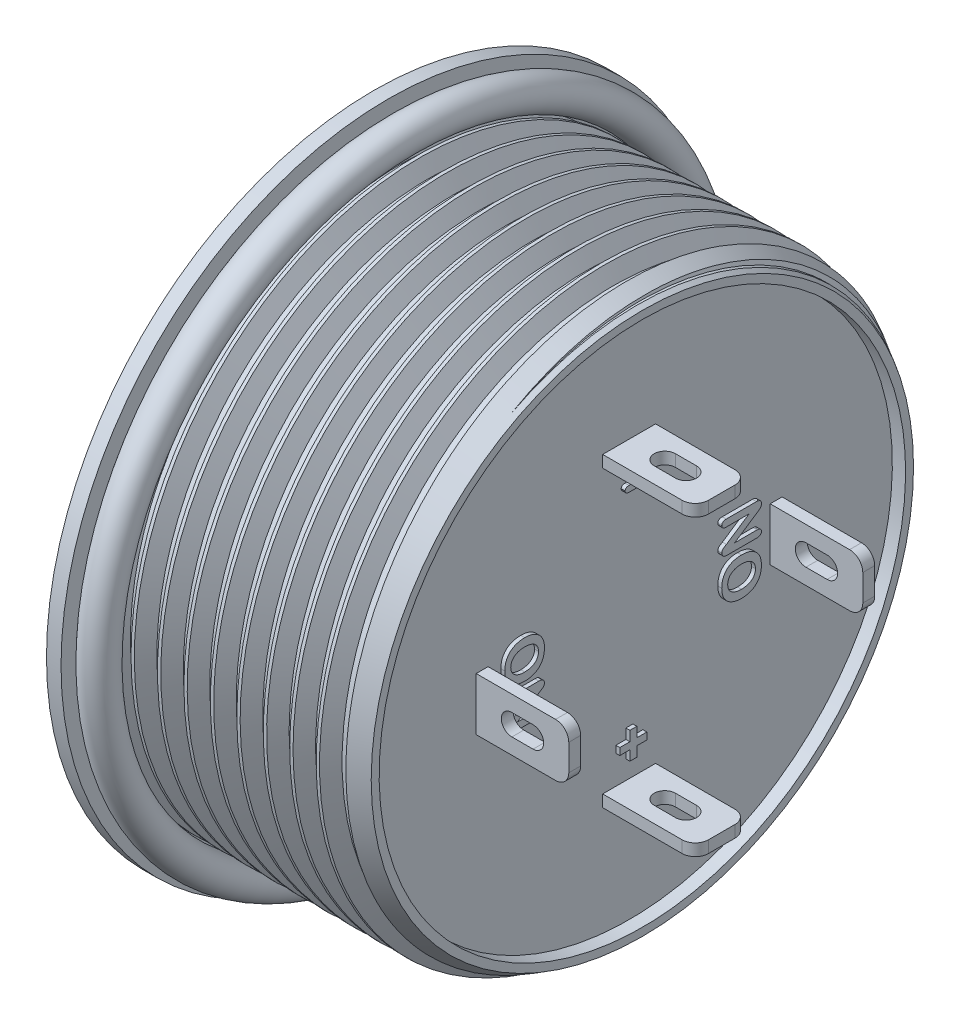
from build123d import *

# Parameters (mm, degrees)
THREAD1_PITCH       = 1
SKETCH6_W           = 0.45
SKETCH6_H           = 2
BOSS_EXTRUDE1_DEPTH = 3.5
CUT_EXTRUDE1_REACH  = 27.329
CIRPATTERN1_COUNT   = 4
BOSS_EXTRUDE2_DEPTH = 0.15
SKETCH9_R           = 0.616867063


with BuildPart() as part:
    # Sketch1 → Revolve1 (revolve)
    with BuildSketch(Plane.XY):
        Polygon((-1.8, 9), (-1.8, 10), (-0.55, 12.375), (0, 12.375), (0, 10.35), (9.6, 10.35), (9.6, 9.95), (9.1, 9.95), (9.1, 0), (-1.8, 0), (-1.8, 7.7), (-1.7, 7.7), (-1.7, 9), align=None)
    revolve(axis=Axis((9.1, 0, 0), (-1, 0, 0)))

    # Thread1: the profile of Thread Profile1 profile screwed along a right-hand helix of 10.6 turns, 8 arcs to a turn; built about Z, then put on its axis
    thread1_z = Axis((0, 0, 0), (0, 0, 1))
    thread1_corners = [(10.3497, 0, -0.000173205), (10.891265875, 0, 0.312499999), (10.891265875, 0, 0.437499999), (10.3497, 0, 0.750173202)]
    with BuildLine(mode=Mode.PRIVATE) as thread1_profile:
        Line(thread1_corners[0], thread1_corners[1])
        Line(thread1_corners[1], thread1_corners[2])
        Line(thread1_corners[2], thread1_corners[3])
        Line(thread1_corners[3], thread1_corners[0])
    thread1_cap = Face(thread1_profile.wire())
    thread1_turn_angles = [0, 22.5, 45, 67.5, 90, 112.5, 135, 157.5, 180, 202.5, 225, 247.5, 270, 292.5, 315, 337.5, 360]
    thread1_turn_weights = [1, 0.9238795325112867, 1, 0.9238795325112867, 1, 0.9238795325112867, 1, 0.9238795325112867, 1, 0.9238795325112867, 1, 0.9238795325112867, 1, 0.9238795325112867, 1, 0.9238795325112867, 1]
    thread1_turn_rails = [Edge.make_bspline([Vector(p[0], p[1], 0).rotate(thread1_z, thread1_turn_angles[k]) / thread1_turn_weights[k] + Vector(0, 0, p[2] + THREAD1_PITCH * thread1_turn_angles[k] / 360) for k in range(17)], [0, 0, 0, 1, 1, 2, 2, 3, 3, 4, 4, 5, 5, 6, 6, 7, 7, 8, 8, 8], 2, thread1_turn_weights) for p in thread1_corners]
    thread1_turn_sides = [Face.make_surface_from_curves(thread1_turn_rails[p[0]], thread1_turn_rails[p[1]]) for p in [(0, 1), (1, 2), (2, 3), (3, 0)]]
    thread1_last_angles = [3600, 3622.5, 3645, 3667.5, 3690, 3712.5, 3735, 3757.5, 3780, 3798, 3816]
    thread1_last_weights = [1, 0.9238795325112867, 1, 0.9238795325112867, 1, 0.9238795325112867, 1, 0.9238795325112867, 1, 0.9510565162951535, 1]
    thread1_last_rails = [Edge.make_bspline([Vector(p[0], p[1], 0).rotate(thread1_z, thread1_last_angles[k]) / thread1_last_weights[k] + Vector(0, 0, p[2] + THREAD1_PITCH * thread1_last_angles[k] / 360) for k in range(11)], [0, 0, 0, 1, 1, 2, 2, 3, 3, 4, 4, 5, 5, 5], 2, thread1_last_weights) for p in thread1_corners]
    thread1_last_sides = [Face.make_surface_from_curves(thread1_last_rails[p[0]], thread1_last_rails[p[1]]) for p in [(0, 1), (1, 2), (2, 3), (3, 0)]]
    thread1 = Plane(origin=(10.6, 0, 0), x_dir=(0, 0, 1), z_dir=(-1, 0, 0)) * Solid(Shell([*[p.moved(Location((0, 0, THREAD1_PITCH * i))) for i in range(10) for p in thread1_turn_sides], *thread1_last_sides, thread1_cap, thread1_cap.rotate(thread1_z, 3816).moved(Location((0, 0, THREAD1_PITCH * 3816 / 360)))]))
    add(thread1)

    # Sketch5 → Cut-Revolve1 (revolve, cut)
    with BuildSketch(Plane.XY, mode=Mode.PRIVATE) as cut_revolve1_sk:
        Polygon((9.6, 10.25), (12.6, 10.25), (12.6, 10.891265875), (8.489294923, 10.891265875), align=None)
    revolve(cut_revolve1_sk.sketch.rotate(Axis((0, 0, 0), (1, 0, 0)), 90), axis=Axis((0, 0, 0), (1, 0, 0)), mode=Mode.SUBTRACT)

    # Sketch6 → Boss-Extrude1 (add)
    with BuildSketch(Plane(origin=(9.1, 0, 0), x_dir=(0, 0, -1), z_dir=(1, 0, 0))):
        with Locations((-5.556836823, 0)):
            Rectangle(SKETCH6_W, SKETCH6_H)
    boss_extrude1 = extrude(amount=BOSS_EXTRUDE1_DEPTH)

    # Sketch7 → Cut-Extrude1 (cut, up to next)
    with BuildSketch(Plane.XY.offset(5.781836823), mode=Mode.PRIVATE) as cut_extrude1_sk1:
        with BuildLine():
            Line((11.25, -0.4), (10.45, -0.4))
            ThreePointArc((10.45, -0.4), (10.05, 0), (10.45, 0.4))
            Line((10.45, 0.4), (11.25, 0.4))
            ThreePointArc((11.25, 0.4), (11.65, 0), (11.25, -0.4))
        make_face()
    cut_extrude1_tool1 = extrude(cut_extrude1_sk1.sketch, amount=-CUT_EXTRUDE1_REACH, mode=Mode.PRIVATE) & part.part
    # Sketch7 → Cut-Extrude1 (cut, up to next)
    with BuildSketch(Plane.XY.offset(5.781836823), mode=Mode.PRIVATE) as cut_extrude1_sk2:
        with BuildLine():
            Line((12.6, 0.5), (12.6, 1))
            Line((12.6, 1), (12.1, 1))
            ThreePointArc((12.1, 1), (12.453553391, 0.853553391), (12.6, 0.5))
        make_face()
    cut_extrude1_tool2 = extrude(cut_extrude1_sk2.sketch, amount=-CUT_EXTRUDE1_REACH, mode=Mode.PRIVATE) & part.part
    # Sketch7 → Cut-Extrude1 (cut, up to next)
    with BuildSketch(Plane.XY.offset(5.781836823), mode=Mode.PRIVATE) as cut_extrude1_sk3:
        with BuildLine():
            Line((12.6, -0.5), (12.6, -1))
            Line((12.6, -1), (12.1, -1))
            ThreePointArc((12.1, -1), (12.453553391, -0.853553391), (12.6, -0.5))
        make_face()
    cut_extrude1_tool3 = extrude(cut_extrude1_sk3.sketch, amount=-CUT_EXTRUDE1_REACH, mode=Mode.PRIVATE) & part.part
    cut_extrude1_1 = cut_extrude1_tool1.solids().sort_by_distance((10.85, 0, 5.781837))[0]
    add(cut_extrude1_1, mode=Mode.SUBTRACT)
    cut_extrude1_2 = cut_extrude1_tool2.solids().sort_by_distance((12.488316, 0.888316, 5.781837))[0]
    add(cut_extrude1_2, mode=Mode.SUBTRACT)
    cut_extrude1_3 = cut_extrude1_tool3.solids().sort_by_distance((12.488316, -0.888316, 5.781837))[0]
    add(cut_extrude1_3, mode=Mode.SUBTRACT)
    cut_extrude1 = cut_extrude1_1 + cut_extrude1_2 + cut_extrude1_3  # Cut-Extrude1 as one shape, for the pattern or mirror that repeats it

    # CirPattern1: Boss-Extrude1, Cut-Extrude1 ×4 about axis
    cirpattern1_axis = Axis((0, 0, 0), (1, 0, 0))
    add([boss_extrude1.rotate(cirpattern1_axis, i * 360 / CIRPATTERN1_COUNT) for i in range(1, CIRPATTERN1_COUNT)])
    add([cut_extrude1.rotate(cirpattern1_axis, i * 360 / CIRPATTERN1_COUNT) for i in range(1, CIRPATTERN1_COUNT)], mode=Mode.SUBTRACT)

    # Sketch8 → Boss-Extrude2 (add)
    # profile 1 of 6: a face of its own
    with BuildSketch(Plane(origin=(9.1, 0, 0), x_dir=(0, 0, -1), z_dir=(1, 0, 0))):
        with BuildLine():
            add(Edge.make_bspline(
                [(3.350586823, -0.698730469), (3.350847386, -0.680165683), (3.351358301, -0.643763666), (3.355991188, -0.590183645), (3.362864212, -0.538506881), (3.372770023, -0.488774819), (3.385650885, -0.441087694), (3.401627861, -0.39555589), (3.41995285, -0.351779536), (3.44138612, -0.310200081), (3.465421796, -0.270796275), (3.492180877, -0.23386837), (3.521151461, -0.19920459), (3.552594521, -0.167164698), (3.586469052, -0.137779361), (3.622620136, -0.110793698), (3.661069967, -0.08598704), (3.702194269, -0.0642313), (3.745264295, -0.04447036), (3.790352348, -0.02762692), (3.837184829, -0.013141071), (3.885926016, -0.00146895), (3.936508457, 0.007573964), (3.988941661, 0.01388259), (4.043090487, 0.018263565), (4.079874686, 0.01858628), (4.098536042, 0.01875)],
                knots=[0, 0, 0, 0, 1.137047366, 2.229533759, 3.292178447, 4.329325218, 5.333582809, 6.31551497, 7.283294629, 8.238474368, 9.178299829, 10.10811393, 11.029576586, 11.943336281, 12.855037405, 13.773933091, 14.70490119, 15.655046909, 16.621494354, 17.605956357, 18.601300719, 19.622801257, 20.674239048, 21.747206774, 22.857113211, 24, 24, 24, 24], degree=3))
            add(Edge.make_bspline(
                [(4.098536042, 0.01875), (4.125900722, 0.018178383), (4.179593422, 0.017056804), (4.258195891, 0.00852968), (4.332936304, -0.005857342), (4.4038344, -0.025607805), (4.470507126, -0.051500266), (4.532979704, -0.082684434), (4.590443973, -0.120319342), (4.643306399, -0.163060682), (4.691176844, -0.211260899), (4.732798107, -0.265241187), (4.768877359, -0.324184605), (4.798382696, -0.388461244), (4.82202491, -0.457612962), (4.838356443, -0.531814159), (4.849046859, -0.610723986), (4.850064382, -0.665002232), (4.850586823, -0.692871094)],
                knots=[0, 0, 0, 0, 1.119865916, 2.197307758, 3.231257501, 4.23213813, 5.205243015, 6.154412566, 7.084548598, 8.010915502, 8.932302275, 9.858125782, 10.79450998, 11.754823778, 12.747047633, 13.779729598, 14.860014573, 16, 16, 16, 16], degree=3))
            add(Edge.make_bspline(
                [(4.850586823, -0.692871094), (4.849911721, -0.720539025), (4.848590085, -0.774704021), (4.838261743, -0.853717835), (4.820995726, -0.928306712), (4.796973739, -0.998198861), (4.766766072, -1.063068309), (4.731058078, -1.122758976), (4.688993207, -1.176440747), (4.641638784, -1.224695597), (4.588951104, -1.267519672), (4.530623309, -1.304030778), (4.46784012, -1.335991581), (4.400008968, -1.36140522), (4.328486138, -1.381692382), (4.253678556, -1.395874414), (4.175987879, -1.404563228), (4.123265952, -1.405681806), (4.09648526, -1.40625)],
                knots=[0, 0, 0, 0, 1.130167388, 2.212507748, 3.249047518, 4.253434918, 5.226276633, 6.167834608, 7.088879855, 8.005845618, 8.924970306, 9.855866769, 10.812287688, 11.798577687, 12.810300658, 13.846348842, 14.906028867, 16, 16, 16, 16], degree=3))
            add(Edge.make_bspline(
                [(4.09648526, -1.40625), (4.069211856, -1.405735805), (4.015582586, -1.404724713), (3.936920287, -1.395319304), (3.861588714, -1.380593312), (3.790070102, -1.359540317), (3.722955551, -1.332674235), (3.660713805, -1.300311227), (3.603568299, -1.26273624), (3.551678428, -1.219807625), (3.505382573, -1.17143399), (3.46484881, -1.117915814), (3.430132607, -1.059383642), (3.400937826, -0.996265441), (3.378509892, -0.928092053), (3.362118892, -0.855623578), (3.352327107, -0.778588013), (3.351176951, -0.725810077), (3.350586823, -0.698730469)],
                knots=[0, 0, 0, 0, 1.125175843, 2.212498295, 3.264530214, 4.289843693, 5.284479034, 6.243495757, 7.180226347, 8.101853028, 9.016873234, 9.937406539, 10.8663711, 11.820335617, 12.801695132, 13.822443789, 14.882726885, 16, 16, 16, 16], degree=3))
        make_face()
        with BuildLine():
            add(Edge.make_bspline(
                [(4.09648526, -0.28125), (4.070377951, -0.281819955), (4.01982815, -0.282923519), (3.94662237, -0.292807804), (3.878671604, -0.308625851), (3.826088678, -0.327694317), (3.787203533, -0.345813335), (3.760280685, -0.360842434), (3.734827455, -0.376891287), (3.711489972, -0.394745059), (3.690040476, -0.414024548), (3.669827118, -0.434095154), (3.652123032, -0.456236787), (3.630573436, -0.487046611), (3.608176643, -0.528513584), (3.589515526, -0.582250809), (3.577617817, -0.639323605), (3.576273302, -0.678650862), (3.575586823, -0.698730469)],
                knots=[0, 0, 0, 0, 1.663441167, 3.220807608, 4.698940809, 6.102955342, 6.776849566, 7.431641978, 8.067093796, 8.693332119, 9.301776027, 9.904814565, 10.506598814, 11.105801949, 12.300613817, 13.49566889, 14.721345304, 16, 16, 16, 16], degree=3))
            add(Edge.make_bspline(
                [(3.575586823, -0.698730469), (3.575944531, -0.713111655), (3.576651506, -0.741534698), (3.583366469, -0.783258312), (3.593865921, -0.823339289), (3.608558349, -0.861584067), (3.627295198, -0.897678179), (3.650103188, -0.931310511), (3.676477825, -0.96250252), (3.707044034, -0.99094083), (3.741906722, -1.016467603), (3.781054431, -1.039378686), (3.824681125, -1.05922804), (3.872386563, -1.076172864), (3.923948422, -1.089568364), (3.978819425, -1.099094897), (4.036685431, -1.10507902), (4.076255526, -1.105853868), (4.09648526, -1.10625)],
                knots=[0, 0, 0, 0, 0.92684585, 1.831822411, 2.717841699, 3.595042865, 4.468278619, 5.334674302, 6.210427342, 7.097184971, 8.020493515, 8.991540693, 10.017312101, 11.106928066, 12.252598863, 13.448510667, 14.695581776, 16, 16, 16, 16], degree=3))
            add(Edge.make_bspline(
                [(4.09648526, -1.10625), (4.116909207, -1.105846543), (4.156964071, -1.105055295), (4.215427971, -1.099159), (4.270950196, -1.089474528), (4.323252345, -1.076218222), (4.371886929, -1.059004379), (4.416321388, -1.038348437), (4.45686797, -1.015188493), (4.492408009, -0.987873725), (4.523739242, -0.958345903), (4.551102438, -0.926736108), (4.574023461, -0.892867705), (4.592924599, -0.856912036), (4.607567249, -0.818942997), (4.618234229, -0.779098305), (4.624416732, -0.737401883), (4.625193566, -0.709004506), (4.625586823, -0.694628906)],
                knots=[0, 0, 0, 0, 1.300468753, 2.550442426, 3.73746137, 4.886805396, 5.982400421, 7.017442263, 8.004046925, 8.949332803, 9.86437081, 10.741934267, 11.606086137, 12.462844372, 13.323228707, 14.192111534, 15.084792948, 16, 16, 16, 16], degree=3))
            add(Edge.make_bspline(
                [(4.625586823, -0.694628906), (4.624968844, -0.676113334), (4.623751215, -0.63963137), (4.612312553, -0.586231701), (4.594477308, -0.535092138), (4.573430697, -0.494841102), (4.553133836, -0.464301707), (4.535931586, -0.442417712), (4.516723575, -0.421747366), (4.495541192, -0.402377414), (4.472319272, -0.384177933), (4.447086447, -0.367264516), (4.420017205, -0.351357167), (4.391060029, -0.336761673), (4.360276001, -0.323559637), (4.327726934, -0.312042796), (4.29335932, -0.302915434), (4.257436204, -0.294820745), (4.219661569, -0.288775214), (4.18016105, -0.284433155), (4.138906037, -0.281720905), (4.110844993, -0.281409405), (4.09648526, -0.28125)],
                knots=[0, 0, 0, 0, 1.468780441, 2.893996027, 4.316698208, 5.759781064, 6.486834761, 7.226926039, 7.967789028, 8.725311726, 9.504171751, 10.308674623, 11.136030953, 11.996215571, 12.882201285, 13.794676098, 14.735421448, 15.704512633, 16.718169161, 17.771633038, 18.859673494, 20, 20, 20, 20], degree=3))
        make_face(mode=Mode.SUBTRACT)
    # profile 2 of 6: a face of its own
    with BuildSketch(Plane(origin=(9.1, 0, 0), x_dir=(0, 0, -1), z_dir=(1, 0, 0))):
        with BuildLine():
            Line((3.526661042, 0.648632813), (4.381836823, 1.21875))
            Line((4.381836823, 1.21875), (3.518750885, 1.21875))
            add(Edge.make_bspline(
                [(3.518750885, 1.21875), (3.505540897, 1.219191967), (3.480798001, 1.220019791), (3.44609093, 1.226260002), (3.416623196, 1.237335456), (3.392264737, 1.252716085), (3.373261914, 1.272060446), (3.360230241, 1.295054746), (3.351919057, 1.320826492), (3.351040759, 1.339093891), (3.350586823, 1.348535156)],
                knots=[0, 0, 0, 0, 1.318579103, 2.469757407, 3.503686935, 4.442186165, 5.324776543, 6.18101498, 7.059881445, 8, 8, 8, 8], degree=3))
            add(Edge.make_bspline(
                [(3.350586823, 1.348535156), (3.351049152, 1.358263656), (3.351944032, 1.377094045), (3.360091523, 1.403609578), (3.373259003, 1.427039568), (3.392235252, 1.446691587), (3.416597945, 1.462353824), (3.446027804, 1.473815573), (3.480806584, 1.479955222), (3.505543885, 1.480799336), (3.518750885, 1.48125)],
                knots=[0, 0, 0, 0, 0.95948334, 1.857166476, 2.713147973, 3.593805668, 4.528102355, 5.555116886, 6.694701036, 8, 8, 8, 8], degree=3))
            Line((3.518750885, 1.48125), (4.659571198, 1.48125))
            add(Edge.make_bspline(
                [(4.659571198, 1.48125), (4.674545874, 1.480888087), (4.702651608, 1.480208818), (4.741950782, 1.472971972), (4.77540165, 1.460767542), (4.803156108, 1.443691692), (4.824931098, 1.421217389), (4.839898112, 1.393433572), (4.849246046, 1.361039613), (4.850124997, 1.337861865), (4.850586823, 1.325683594)],
                knots=[0, 0, 0, 0, 1.276164049, 2.395212213, 3.391561633, 4.297456637, 5.151673506, 6.027862746, 6.963780962, 8, 8, 8, 8], degree=3))
            add(Edge.make_bspline(
                [(4.850586823, 1.325683594), (4.85004998, 1.313324121), (4.849013523, 1.289462289), (4.840277273, 1.255346101), (4.825611454, 1.223935357), (4.803461766, 1.196027808), (4.776820304, 1.169643025), (4.745618166, 1.145939779), (4.712303804, 1.123009351), (4.689752476, 1.107610415), (4.678321198, 1.099804688)],
                knots=[0, 0, 0, 0, 0.990448595, 1.912210775, 2.80600298, 3.75105296, 4.75397718, 5.808939437, 6.889350376, 8, 8, 8, 8], degree=3))
            Line((4.678321198, 1.099804688), (3.838086823, 0.54375))
            Line((3.838086823, 0.54375), (4.683301667, 0.54375))
            add(Edge.make_bspline(
                [(4.683301667, 0.54375), (4.696216216, 0.543305746), (4.720679661, 0.542464215), (4.755024373, 0.536123123), (4.784232483, 0.524157155), (4.808361669, 0.508030182), (4.827080276, 0.487984403), (4.84101639, 0.465378865), (4.849189095, 0.439699414), (4.850112125, 0.421737489), (4.850586823, 0.4125)],
                knots=[0, 0, 0, 0, 1.293715002, 2.450625542, 3.477086601, 4.434913996, 5.334623654, 6.203708306, 7.076200069, 8, 8, 8, 8], degree=3))
            add(Edge.make_bspline(
                [(4.850586823, 0.4125), (4.850136503, 0.403061967), (4.849259337, 0.384677886), (4.840781334, 0.358654964), (4.826789927, 0.335767488), (4.807886964, 0.31578013), (4.783272882, 0.30022807), (4.75389468, 0.28911992), (4.719728889, 0.282448199), (4.695345593, 0.281665056), (4.68242276, 0.28125)],
                knots=[0, 0, 0, 0, 0.938889884, 1.828837584, 2.693878765, 3.596100726, 4.546832571, 5.570326044, 6.712304089, 8, 8, 8, 8], degree=3))
            Line((4.68242276, 0.28125), (3.563282135, 0.28125))
            add(Edge.make_bspline(
                [(3.563282135, 0.28125), (3.552040983, 0.281359913), (3.530785022, 0.281567747), (3.500855168, 0.2846418), (3.474514033, 0.288842489), (3.458742173, 0.294049737), (3.451368073, 0.296484375)],
                knots=[0, 0, 0, 0, 1.18793306, 2.246269525, 3.180047019, 4, 4, 4, 4], degree=3))
            add(Edge.make_bspline(
                [(3.451368073, 0.296484375), (3.444194057, 0.299752397), (3.429871533, 0.306276822), (3.410870728, 0.320562881), (3.393212232, 0.336988793), (3.378318842, 0.356507105), (3.365880799, 0.377798193), (3.357155089, 0.400463542), (3.351562658, 0.423948986), (3.350913684, 0.439910209), (3.350586823, 0.447949219)],
                knots=[0, 0, 0, 0, 0.980240752, 1.956996058, 2.947544725, 3.980306799, 5.005864808, 6.012156315, 6.998805169, 8, 8, 8, 8], degree=3))
            add(Edge.make_bspline(
                [(3.350586823, 0.447949219), (3.351074659, 0.459951394), (3.351989441, 0.482457664), (3.362249613, 0.513635998), (3.377900658, 0.539765639), (3.398233412, 0.562944432), (3.42393048, 0.584303865), (3.455318752, 0.604654864), (3.490252446, 0.626043361), (3.514363565, 0.641002932), (3.526661042, 0.648632813)],
                knots=[0, 0, 0, 0, 1.017097424, 1.907243451, 2.755957003, 3.591737331, 4.516676023, 5.587529, 6.769559203, 8, 8, 8, 8], degree=3))
        make_face()
    # profile 3 of 6: a face of its own
    with BuildSketch(Plane(origin=(9.1, 0, 0), x_dir=(0, 0, -1), z_dir=(1, 0, 0))):
        Polygon((-0.121875, -4.625586823), (0.140625, -4.625586823), (0.140625, -4.250586823), (0.519140625, -4.250586823), (0.519140625, -3.988086823), (0.140625, -3.988086823), (0.140625, -3.613086823), (-0.121875, -3.613086823), (-0.121875, -3.988086823), (-0.502441406, -3.988086823), (-0.502441406, -4.250586823), (-0.121875, -4.250586823), align=None)
    # profile 4 of 6: a face of its own
    with BuildSketch(Plane(origin=(9.1, 0, 0), x_dir=(0, 0, -1), z_dir=(1, 0, 0))):
        with BuildLine():
            Line((0.155273438, 4.419336823), (-0.155273437, 4.419336823))
            add(Edge.make_bspline(
                [(-0.155273437, 4.419336823), (-0.166438567, 4.418979793), (-0.187477014, 4.418307042), (-0.216938852, 4.41239704), (-0.242446253, 4.402995623), (-0.263246766, 4.388940132), (-0.27964586, 4.372012766), (-0.291808167, 4.352648135), (-0.298653084, 4.330618368), (-0.299543723, 4.315280427), (-0.3, 4.30742276)],
                knots=[0, 0, 0, 0, 1.299412411, 2.44848203, 3.485843179, 4.445087476, 5.346237763, 6.214544026, 7.085306396, 8, 8, 8, 8], degree=3))
            add(Edge.make_bspline(
                [(-0.3, 4.30742276), (-0.299559636, 4.29936509), (-0.298705085, 4.283728714), (-0.291783413, 4.261557219), (-0.280227164, 4.241864846), (-0.26422661, 4.224754095), (-0.243560309, 4.210617298), (-0.218016959, 4.201241086), (-0.188159938, 4.19533609), (-0.166731863, 4.194684991), (-0.155273437, 4.194336823)],
                knots=[0, 0, 0, 0, 0.93058771, 1.805859441, 2.656291502, 3.551380498, 4.494361156, 5.524252496, 6.67612143, 8, 8, 8, 8], degree=3))
            Line((-0.155273437, 4.194336823), (0.155273438, 4.194336823))
            add(Edge.make_bspline(
                [(0.155273438, 4.194336823), (0.16673306, 4.194680724), (0.188163372, 4.195323843), (0.218095488, 4.201298839), (0.243767238, 4.210557374), (0.264527042, 4.22466235), (0.280210487, 4.241968249), (0.291797028, 4.261544842), (0.298701386, 4.283732077), (0.299558378, 4.299366234), (0.3, 4.30742276)],
                knots=[0, 0, 0, 0, 1.323402272, 2.474856794, 3.514911164, 4.457552563, 5.344664163, 6.194790261, 7.069747091, 8, 8, 8, 8], degree=3))
            add(Edge.make_bspline(
                [(0.3, 4.30742276), (0.299523055, 4.315276624), (0.298593818, 4.33057837), (0.292086919, 4.352537725), (0.280573662, 4.371977736), (0.264714781, 4.389011977), (0.244140479, 4.403049401), (0.218516489, 4.412480054), (0.188446925, 4.418325574), (0.166828034, 4.418984597), (0.155273438, 4.419336823)],
                knots=[0, 0, 0, 0, 0.911547891, 1.775976195, 2.629630521, 3.512087315, 4.458640903, 5.492434473, 6.659787555, 8, 8, 8, 8], degree=3))
        make_face()
    # profile 5 of 6: a face of its own
    with BuildSketch(Plane(origin=(9.1, 0, 0), x_dir=(0, 0, -1), z_dir=(1, 0, 0))):
        with BuildLine():
            add(Edge.make_bspline(
                [(-3.350586823, 0.698730469), (-3.350846648, 0.680165533), (-3.351356117, 0.643763224), (-3.355999431, 0.590185316), (-3.362821949, 0.538595823), (-3.372854285, 0.48889132), (-3.385616571, 0.441180389), (-3.401555194, 0.395481642), (-3.420321681, 0.351855345), (-3.441636601, 0.310176136), (-3.465761992, 0.270898706), (-3.492143579, 0.233771249), (-3.521175011, 0.19922414), (-3.552573536, 0.167139504), (-3.586574174, 0.137822468), (-3.622555443, 0.11036886), (-3.661335858, 0.08579947), (-3.702479555, 0.063932485), (-3.745426392, 0.044183594), (-3.790570923, 0.027580082), (-3.837305788, 0.013230053), (-3.886011788, 0.001420302), (-3.936510601, -0.007565099), (-3.988941063, -0.013885064), (-4.043090644, -0.018262916), (-4.079874739, -0.018586062), (-4.098536042, -0.01875)],
                knots=[0, 0, 0, 0, 1.137066105, 2.229570503, 3.292232704, 4.323530924, 5.333579611, 6.315527955, 7.285669022, 8.240864503, 9.180705453, 10.107044884, 11.028522726, 11.942297481, 12.85401363, 13.776520156, 14.712545252, 15.662706631, 16.629170003, 17.605947325, 18.607026799, 19.622729118, 20.674184238, 21.747169647, 22.857094376, 24, 24, 24, 24], degree=3))
            add(Edge.make_bspline(
                [(-4.098536042, -0.01875), (-4.12590059, -0.018177747), (-4.179593029, -0.01705492), (-4.258197367, -0.008536765), (-4.333023467, 0.005900231), (-4.404033639, 0.025572218), (-4.470762416, 0.051393597), (-4.532981142, 0.082906585), (-4.590783009, 0.119890223), (-4.643690221, 0.162791634), (-4.69135101, 0.21126638), (-4.733173086, 0.26513069), (-4.768757257, 0.324356391), (-4.79875072, 0.388371305), (-4.822376734, 0.457586716), (-4.838261968, 0.531854705), (-4.849073263, 0.610718742), (-4.850073339, 0.665000453), (-4.850586823, 0.692871094)],
                knots=[0, 0, 0, 0, 1.11965245, 2.196888913, 3.230641567, 4.235178043, 5.208097437, 6.153520211, 7.084663091, 8.010853413, 8.934911852, 9.860558881, 10.794689754, 11.756507251, 12.748541972, 13.78015282, 14.860231874, 16, 16, 16, 16], degree=3))
            add(Edge.make_bspline(
                [(-4.850586823, 0.692871094), (-4.849920649, 0.720540937), (-4.848616492, 0.774709676), (-4.838165965, 0.853674851), (-4.821354792, 0.928338522), (-4.797317985, 0.998274473), (-4.766708066, 1.06299393), (-4.731078627, 1.12276919), (-4.688987375, 1.176437219), (-4.641641853, 1.224699635), (-4.588944604, 1.267506939), (-4.530758101, 1.304009027), (-4.467986674, 1.33569175), (-4.400231509, 1.361207398), (-4.328530631, 1.381251251), (-4.253720327, 1.395986879), (-4.175981792, 1.404533241), (-4.123263901, 1.405671705), (-4.09648526, 1.40625)],
                knots=[0, 0, 0, 0, 1.130164875, 2.212502828, 3.248141438, 4.252526604, 5.227058358, 6.168614239, 7.089657438, 8.006621161, 8.925743806, 9.856638199, 10.807698953, 11.79398676, 12.809547429, 13.846353631, 14.906031299, 16, 16, 16, 16], degree=3))
            add(Edge.make_bspline(
                [(-4.09648526, 1.40625), (-4.069213805, 1.405725177), (-4.015588366, 1.404693188), (-3.936974406, 1.39544778), (-3.861816653, 1.380198862), (-3.790359697, 1.359125251), (-3.722953012, 1.332818782), (-3.660739506, 1.300265168), (-3.603463664, 1.262769676), (-3.551764953, 1.219502732), (-3.505463379, 1.171181125), (-3.464787199, 1.117872868), (-3.430057613, 1.059456325), (-3.401379795, 0.996129482), (-3.378444672, 0.928252647), (-3.362084028, 0.855721888), (-3.352343253, 0.778684757), (-3.351181705, 0.725810019), (-3.350586823, 0.698730469)],
                knots=[0, 0, 0, 0, 1.125306766, 2.212755736, 3.261755221, 4.287188004, 5.284190462, 6.243318774, 7.180158359, 8.104470978, 9.019597654, 9.937029439, 10.866102092, 11.818498761, 12.801254546, 13.818191362, 14.882596881, 16, 16, 16, 16], degree=3))
        make_face()
        with BuildLine():
            add(Edge.make_bspline(
                [(-4.09648526, 0.28125), (-4.070376394, 0.281812892), (-4.019823577, 0.282902782), (-3.94675561, 0.292867093), (-3.878842721, 0.308307943), (-3.826362505, 0.327372398), (-3.787453612, 0.345617545), (-3.760250234, 0.360430919), (-3.734929144, 0.376828253), (-3.711755357, 0.394939162), (-3.69003535, 0.413813666), (-3.670143418, 0.434215769), (-3.652400899, 0.456220001), (-3.63086418, 0.487052362), (-3.608548901, 0.528574247), (-3.589426841, 0.582185139), (-3.577643119, 0.639332472), (-3.576281854, 0.678653859), (-3.575586823, 0.698730469)],
                knots=[0, 0, 0, 0, 1.66356621, 3.221049721, 4.691803351, 6.095923426, 6.769868308, 7.430161524, 8.069036679, 8.690383159, 9.303536115, 9.902266695, 10.504096182, 11.103344359, 12.298246043, 13.495480635, 14.721249186, 16, 16, 16, 16], degree=3))
            add(Edge.make_bspline(
                [(-3.575586823, 0.698730469), (-3.575944558, 0.713111633), (-3.576651586, 0.741534631), (-3.583366162, 0.78325857), (-3.593867044, 0.823338347), (-3.608554206, 0.861587539), (-3.627310538, 0.897665322), (-3.650081718, 0.931410982), (-3.676780309, 0.962415026), (-3.707293593, 0.990860801), (-3.741947014, 1.016540206), (-3.780993049, 1.039421612), (-3.824753122, 1.058882082), (-3.872423646, 1.075819217), (-3.923899432, 1.089661434), (-3.978826349, 1.099067264), (-4.036683575, 1.105086426), (-4.076254898, 1.105856374), (-4.09648526, 1.10625)],
                knots=[0, 0, 0, 0, 0.926960378, 1.832048765, 2.718177536, 3.595487096, 4.468830754, 5.335333494, 6.215284572, 7.102151775, 8.020512279, 8.991679447, 10.014963899, 11.104714506, 12.252135806, 13.448195385, 14.695420592, 16, 16, 16, 16], degree=3))
            add(Edge.make_bspline(
                [(-4.09648526, 1.10625), (-4.116910903, 1.105856196), (-4.156871905, 1.105085753), (-4.215311664, 1.099065966), (-4.27092109, 1.089644195), (-4.323136721, 1.07574126), (-4.371954556, 1.059105559), (-4.416311783, 1.038319797), (-4.456870804, 1.015196011), (-4.492405786, 0.987870611), (-4.523745133, 0.958350955), (-4.551170956, 0.926616856), (-4.574244807, 0.892697909), (-4.593296559, 0.856684416), (-4.607427773, 0.818663609), (-4.618304283, 0.779022495), (-4.62440207, 0.737397246), (-4.625188638, 0.709002947), (-4.625586823, 0.694628906)],
                knots=[0, 0, 0, 0, 1.3004819, 2.54428031, 3.737437004, 4.888356273, 5.981895373, 7.016947678, 8.003562314, 8.948857747, 9.863905005, 10.741477332, 11.614277087, 12.471043982, 13.329209093, 14.192093259, 15.084783696, 16, 16, 16, 16], degree=3))
            add(Edge.make_bspline(
                [(-4.625586823, 0.694628906), (-4.62496672, 0.676114464), (-4.623744906, 0.639634727), (-4.612336902, 0.586218746), (-4.594400462, 0.535183437), (-4.573748225, 0.494774537), (-4.553404496, 0.46431935), (-4.536241389, 0.442311351), (-4.516710594, 0.421851651), (-4.49556604, 0.402349826), (-4.472346672, 0.38427883), (-4.447346953, 0.367169292), (-4.42029962, 0.351372481), (-4.391355895, 0.336757685), (-4.360568431, 0.323559516), (-4.328018991, 0.31204766), (-4.293564482, 0.302870643), (-4.257524885, 0.294861193), (-4.219663143, 0.288768019), (-4.180160609, 0.284435173), (-4.138906155, 0.281720365), (-4.110845033, 0.281409222), (-4.09648526, 0.28125)],
                knots=[0, 0, 0, 0, 1.468568495, 2.893578421, 4.316075305, 5.755382189, 6.482330971, 7.222315454, 7.968369796, 8.725783183, 9.504530818, 10.302500265, 11.129737207, 11.9897977, 12.875655565, 13.787998707, 14.728608307, 15.705132475, 16.718642732, 17.771954593, 18.859838044, 20, 20, 20, 20], degree=3))
        make_face(mode=Mode.SUBTRACT)
    # profile 6 of 6: a face of its own
    with BuildSketch(Plane(origin=(9.1, 0, 0), x_dir=(0, 0, -1), z_dir=(1, 0, 0))):
        with BuildLine():
            Line((-3.526661042, -0.648632813), (-4.381836823, -1.21875))
            Line((-4.381836823, -1.21875), (-3.518750885, -1.21875))
            add(Edge.make_bspline(
                [(-3.518750885, -1.21875), (-3.505524777, -1.219012036), (-3.480728319, -1.219503303), (-3.446226609, -1.226498391), (-3.416500393, -1.236806511), (-3.39259571, -1.252861823), (-3.373583881, -1.272110636), (-3.360173302, -1.294971029), (-3.351938758, -1.32083638), (-3.351047472, -1.33909726), (-3.350586823, -1.348535156)],
                knots=[0, 0, 0, 0, 1.31804684, 2.471089218, 3.501571717, 4.437236471, 5.319832591, 6.181003147, 7.05987533, 8, 8, 8, 8], degree=3))
            add(Edge.make_bspline(
                [(-3.350586823, -1.348535156), (-3.351057868, -1.358258356), (-3.351969618, -1.377078484), (-3.360012937, -1.403713393), (-3.373685418, -1.426979941), (-3.392369082, -1.446887744), (-3.416596149, -1.462781819), (-3.446107716, -1.473706577), (-3.480792871, -1.479990423), (-3.505539112, -1.480811588), (-3.518750885, -1.48125)],
                knots=[0, 0, 0, 0, 0.959450181, 1.857102296, 2.717883545, 3.605517373, 4.531720496, 5.555201377, 6.694746145, 8, 8, 8, 8], degree=3))
            Line((-3.518750885, -1.48125), (-4.659571198, -1.48125))
            add(Edge.make_bspline(
                [(-4.659571198, -1.48125), (-4.674545874, -1.480888087), (-4.702651608, -1.480208818), (-4.741950782, -1.472971972), (-4.77540165, -1.460767542), (-4.803156108, -1.443691692), (-4.824931098, -1.421217389), (-4.839898112, -1.393433572), (-4.849246046, -1.361039613), (-4.850124997, -1.337861865), (-4.850586823, -1.325683594)],
                knots=[0, 0, 0, 0, 1.276164049, 2.395212213, 3.391561633, 4.297456637, 5.151673506, 6.027862746, 6.963780962, 8, 8, 8, 8], degree=3))
            add(Edge.make_bspline(
                [(-4.850586823, -1.325683594), (-4.850022705, -1.313332007), (-4.848939007, -1.289603979), (-4.840603887, -1.255365414), (-4.825615804, -1.224069837), (-4.803480174, -1.196023764), (-4.776929012, -1.169719609), (-4.745666393, -1.146106252), (-4.712432439, -1.12306272), (-4.689757943, -1.107602592), (-4.678321198, -1.099804688)],
                knots=[0, 0, 0, 0, 0.990342685, 1.902498836, 2.80664442, 3.751593345, 4.754410321, 5.798261093, 6.88946914, 8, 8, 8, 8], degree=3))
            Line((-4.678321198, -1.099804688), (-3.838086823, -0.54375))
            Line((-3.838086823, -0.54375), (-4.683301667, -0.54375))
            add(Edge.make_bspline(
                [(-4.683301667, -0.54375), (-4.696222831, -0.543321466), (-4.720698804, -0.542509713), (-4.755013417, -0.535960628), (-4.784537766, -0.524601776), (-4.808606158, -0.508273209), (-4.827527826, -0.488335514), (-4.8408779, -0.465334275), (-4.849223311, -0.439720102), (-4.850123746, -0.421744515), (-4.850586823, -0.4125)],
                knots=[0, 0, 0, 0, 1.292293356, 2.447932582, 3.478653403, 4.435428255, 5.334149234, 6.205682227, 7.07721522, 8, 8, 8, 8], degree=3))
            add(Edge.make_bspline(
                [(-4.850586823, -0.4125), (-4.850138146, -0.403060231), (-4.849264181, -0.384672768), (-4.840763343, -0.358673973), (-4.826893308, -0.335757722), (-4.807688507, -0.316119863), (-4.783390296, -0.300153667), (-4.753873917, -0.289148746), (-4.719735126, -0.282439541), (-4.695347754, -0.281662057), (-4.68242276, -0.28125)],
                knots=[0, 0, 0, 0, 0.939088883, 1.82922521, 2.694449737, 3.589845486, 4.546100667, 5.569811071, 6.712031159, 8, 8, 8, 8], degree=3))
            Line((-4.68242276, -0.28125), (-3.563282135, -0.28125))
            add(Edge.make_bspline(
                [(-3.563282135, -0.28125), (-3.552040983, -0.281359913), (-3.530785022, -0.281567747), (-3.500855168, -0.2846418), (-3.474514033, -0.288842489), (-3.458742173, -0.294049737), (-3.451368073, -0.296484375)],
                knots=[0, 0, 0, 0, 1.18793306, 2.246269525, 3.180047019, 4, 4, 4, 4], degree=3))
            add(Edge.make_bspline(
                [(-3.451368073, -0.296484375), (-3.444212196, -0.299776895), (-3.429977608, -0.306326429), (-3.410687787, -0.320236721), (-3.393308861, -0.336925512), (-3.378601504, -0.356576856), (-3.366239666, -0.377860012), (-3.357078229, -0.400395264), (-3.351584115, -0.42395732), (-3.350920871, -0.439913001), (-3.350586823, -0.447949219)],
                knots=[0, 0, 0, 0, 0.98043677, 1.95030105, 2.949471588, 3.975017731, 5.000780821, 6.011758806, 6.99860496, 8, 8, 8, 8], degree=3))
            add(Edge.make_bspline(
                [(-3.350586823, -0.447949219), (-3.351086721, -0.459948272), (-3.352028006, -0.48254193), (-3.362160529, -0.513714796), (-3.377745929, -0.539992894), (-3.39805598, -0.563147079), (-3.424160899, -0.584329265), (-3.455332949, -0.60487667), (-3.490393915, -0.62607251), (-3.514372797, -0.640988796), (-3.526661042, -0.648632813)],
                knots=[0, 0, 0, 0, 1.016715769, 1.914428467, 2.751460418, 3.598636598, 4.517885331, 5.599858742, 6.770020912, 8, 8, 8, 8], degree=3))
        make_face()
    extrude(amount=BOSS_EXTRUDE2_DEPTH)


with BuildPart() as body_2:
    # Sketch9 → Revolve2 (revolve)
    with BuildSketch(Plane.XY, mode=Mode.PRIVATE) as revolve2_sk:
        with Locations((0.616867063, -11.558132938)):
            Circle(SKETCH9_R)
    revolve(revolve2_sk.sketch.rotate(Axis((9.1, 0, 0), (-1, 0, 0)), 90), axis=Axis((9.1, 0, 0), (-1, 0, 0)))


solid = Compound([part.part, body_2.part])
